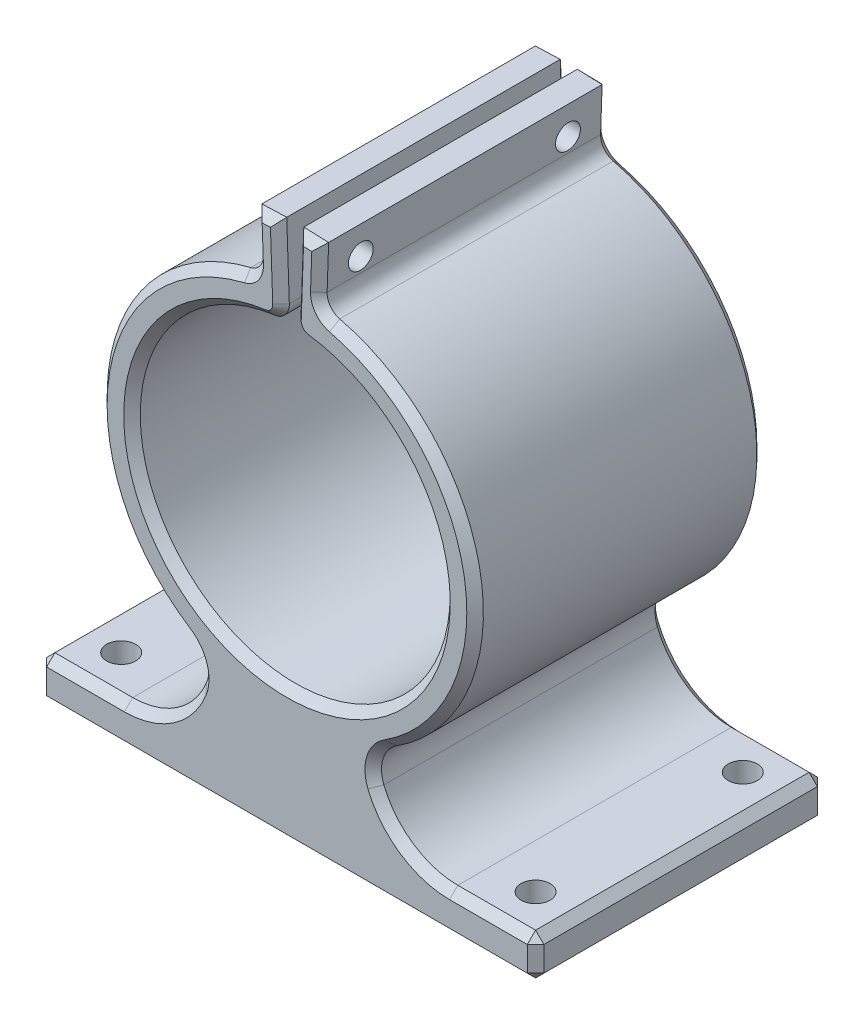
from build123d import *

# Parameters (mm, degrees)
BOSS_EXTRUDE1_DEPTH     = 35
CUT_EXTRUDE1_DEPTH      = 58.879184514
CUT_EXTRUDE1_DEPTH_BACK = 58.879184514
SKETCH2_R               = 1.5
SKETCH3_R               = 1.75
CUT_EXTRUDE2_DEPTH      = 76.254352042
FILLET1_R               = 4
FILLET2_R               = 2
CHAMFER1_SIZE           = 1


with BuildPart() as part:
    # Sketch1 → Boss-Extrude1 (new body)
    with BuildSketch(Plane.XY):
        with BuildLine():
            Line((-0.652620588, 18.688608465), (-1.029566174, 29.482917727))
            Line((-1.029566174, 29.482917727), (-4.027738655, 29.378219237))
            Line((-4.027738655, 29.378219237), (-3.783442178, 22.382483448))
            ThreePointArc((-3.783442178, 22.382483448), (-22.463854977, 3.265764775), (-10, -20.378665314))
            ThreePointArc((-10, -20.378665314), (-12.818023685, -27.181976315), (-19.621334686, -30))
            Line((-19.621334686, -30), (-30, -30))
            Line((-30, -30), (-30, -35))
            Line((-30, -35), (30, -35))
            Line((30, -35), (30, -30))
            Line((30, -30), (19.621334686, -30))
            ThreePointArc((19.621334686, -30), (12.818023685, -27.181976315), (10, -20.378665314))
            ThreePointArc((10, -20.378665314), (22.463854977, 3.265764775), (3.783442178, 22.382483448))
            Line((3.783442178, 22.382483448), (4.027738655, 29.378219237))
            Line((4.027738655, 29.378219237), (1.029566174, 29.482917727))
            Line((1.029566174, 29.482917727), (0.652620588, 18.688608465))
            ThreePointArc((0.652620588, 18.688608465), (0, -18.7), (-0.652620588, 18.688608465))
        make_face()
    extrude(amount=BOSS_EXTRUDE1_DEPTH)

    # Sketch2 → Cut-Extrude1 (cut, two sides: drawn at the far end of the back side and taken through both)
    with BuildSketch(Plane(origin=(0, 0, 0), x_dir=(0, 0, -1), z_dir=(1, 0, 0)).offset(-CUT_EXTRUDE1_DEPTH_BACK)):
        with Locations((-30, 25.880351342)):
            Circle(SKETCH2_R)
        with Locations((-5, 25.880351342)):
            Circle(SKETCH2_R)
    extrude(amount=CUT_EXTRUDE1_DEPTH + CUT_EXTRUDE1_DEPTH_BACK, mode=Mode.SUBTRACT)

    # Sketch3 → Cut-Extrude2 (cut, through all)
    with BuildSketch(Plane(origin=(0, -30, 0), x_dir=(1, 0, 0), z_dir=(0, 1, 0))):
        with Locations((-25, -5)):
            Circle(SKETCH3_R)
        with Locations((-25, -30)):
            Circle(SKETCH3_R)
        with Locations((25, -30)):
            Circle(SKETCH3_R)
        with Locations((25, -5)):
            Circle(SKETCH3_R)
    extrude(amount=-CUT_EXTRUDE2_DEPTH, mode=Mode.SUBTRACT)

    # Fillet1
    fillet1_edges = [part.edges().sort_by_distance(p)[0] for p in [
        (-10, -20.378665314, 17.5),
        (10, -20.378665314, 17.5),
    ]]
    fillet(fillet1_edges, radius=FILLET1_R)

    # Fillet2
    fillet2_edges = [part.edges().sort_by_distance(p)[0] for p in [
        (3.783442178, 22.382483448, 17.5),
        (-0.652620588, 18.688608465, 17.5),
        (0.652620588, 18.688608465, 17.5),
        (-3.783442178, 22.382483448, 17.5),
    ]]
    fillet(fillet2_edges, radius=FILLET2_R)

    # Chamfer1
    chamfer1_edges = [part.edges().sort_by_distance(p)[0] for p in [
        (30, -32.5, 0),
        (24.810667343, -30, 0),
        (14.237242127, -28.352474219, 0),
        (3.935041139, 26.723709689, 0),
        (2.528652414, 29.430568482, 0),
        (0.874302959, 25.03676097, 0),
        (0, -18.7, 0),
        (-0.874302959, 25.03676097, 0),
        (-2.528652414, 29.430568482, 0),
        (-3.935041139, 26.723709689, 0),
        (-14.237242127, -28.352474219, 0),
        (-24.810667343, -30, 0),
        (-30, -32.5, 0),
        (0, -35, 0),
        (-30, -32.5, 35),
        (-24.810667343, -30, 35),
        (-14.237242127, -28.352474219, 35),
        (-3.935041139, 26.723709689, 35),
        (-2.528652414, 29.430568482, 35),
        (-0.874302959, 25.03676097, 35),
        (0, -18.7, 35),
        (0.874302959, 25.03676097, 35),
        (2.528652414, 29.430568482, 35),
        (3.935041139, 26.723709689, 35),
        (14.237242127, -28.352474219, 35),
        (24.810667343, -30, 35),
        (30, -32.5, 35),
        (0, -35, 35),
        (-4.247231716, 22.791302098, 0),
        (-22.389427552, 3.742129593, 0),
        (-10.596614621, -21.263212351, 0),
        (10.596614621, -21.263212351, 0),
        (22.389427552, 3.742129593, 0),
        (4.247231716, 22.791302098, 0),
        (1.190855047, 19.229149784, 0),
        (-1.190855047, 19.229149784, 0),
        (1.190855047, 19.229149784, 35),
        (4.247231716, 22.791302098, 35),
        (22.389427552, 3.742129593, 35),
        (10.596614621, -21.263212351, 35),
        (-10.596614621, -21.263212351, 35),
        (-22.389427552, 3.742129593, 35),
        (-4.247231716, 22.791302098, 35),
        (-1.190855047, 19.229149784, 35),
        (-30, -30, 17.5),
        (-30, -35, 17.5),
        (30, -35, 17.5),
        (30, -30, 17.5),
    ]]
    chamfer(chamfer1_edges, length=CHAMFER1_SIZE)


solid = part.part
